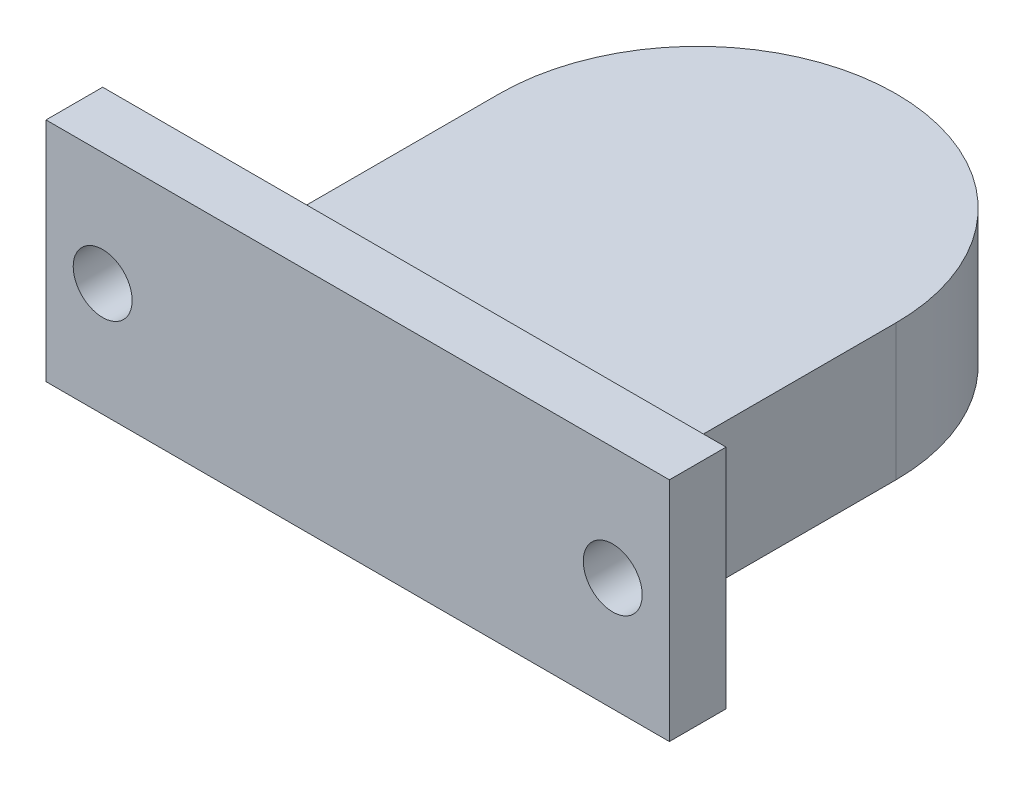
from build123d import *

# Parameters (mm, degrees)
SKETCH1_R           = 11.1
BOSS_EXTRUDE1_DEPTH = 12
BOSS_EXTRUDE2_START = -2
SKETCH3_R           = 11.1
BOSS_EXTRUDE2_DEPTH = 2
SKETCH4_W           = 55
SKETCH4_H           = 5
BOSS_EXTRUDE3_DEPTH = 20
SKETCH5_R           = 2.6
CUT_EXTRUDE1_DEPTH  = 55.428852643
CHAMFER1_SIZE       = 8


with BuildPart() as part:
    # Sketch1 → Boss-Extrude1 (new body)
    with BuildSketch(Plane(origin=(0, 0, 0), x_dir=(1, 0, 0), z_dir=(0, 1, 0))):
        with BuildLine():
            Line((-17.5, 0), (-17.5, -25))
            Line((-17.5, -25), (17.5, -25))
            Line((17.5, -25), (17.5, 0))
            ThreePointArc((17.5, 0), (0, 17.5), (-17.5, 0))
        make_face()
        with Locations(Location((0, 0, 0), (0, 0, 270))):
            Circle(SKETCH1_R, mode=Mode.SUBTRACT)
    extrude(amount=BOSS_EXTRUDE1_DEPTH)

    # Sketch3 → Boss-Extrude2 (add)
    with BuildSketch(Plane(origin=(0, 12, 0), x_dir=(1, 0, 0), z_dir=(0, 1, 0)).offset(BOSS_EXTRUDE2_START)):
        with Locations(Location((0, 0, 0), (0, 0, 270))):
            Circle(SKETCH3_R)
    extrude(amount=BOSS_EXTRUDE2_DEPTH)

    # Sketch4 → Boss-Extrude3 (add)
    with BuildSketch(Plane(origin=(0, 0, 0), x_dir=(1, 0, 0), z_dir=(0, 1, 0))):
        with Locations((0, -27.5)):
            Rectangle(SKETCH4_W, SKETCH4_H)
    extrude(amount=BOSS_EXTRUDE3_DEPTH)

    # Sketch5 → Cut-Extrude1 (cut, through all)
    with BuildSketch(Plane(origin=(0, 0, 25), x_dir=(-1, 0, 0), z_dir=(0, 0, -1))):
        with Locations((22.5, 10)):
            Circle(SKETCH5_R)
        with Locations((-22.5, 10)):
            Circle(SKETCH5_R)
    extrude(amount=-CUT_EXTRUDE1_DEPTH, mode=Mode.SUBTRACT)

    # Chamfer1
    chamfer1_edges = [part.edges().sort_by_distance(p)[0] for p in [
        (0, 12, 25),
    ]]
    chamfer(chamfer1_edges, length=CHAMFER1_SIZE - 0.0001)  # a hair under: the kernel refuses the full size


solid = part.part
